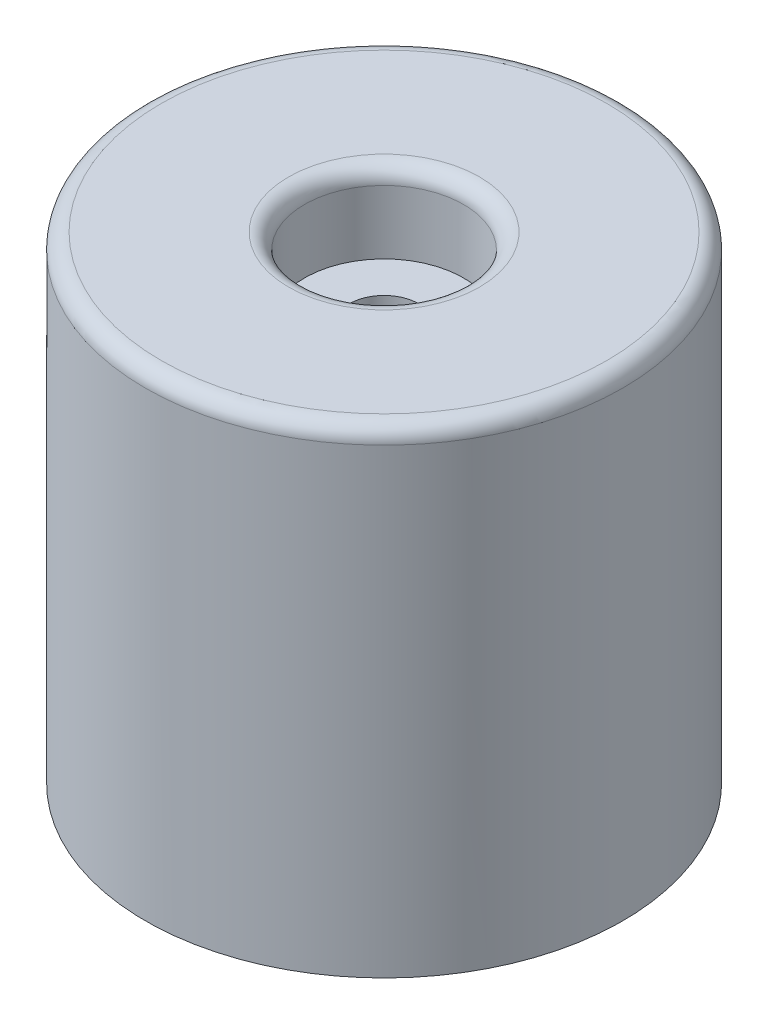
from build123d import *

# Parameters (mm, degrees)
SKETCH1_R           = 19.05
BOSS_EXTRUDE1_DEPTH = 38.1
SKETCH2_R           = 6.35
CUT_EXTRUDE1_DEPTH  = 6.35
SKETCH3_R           = 2.778125
CUT_EXTRUDE2_DEPTH  = 42.639734629
FILLET1_R           = 1.27


with BuildPart() as part:
    # Sketch1 → Boss-Extrude1 (new body)
    with BuildSketch(Plane(origin=(0, 0, 0), x_dir=(1, 0, 0), z_dir=(0, 1, 0))):
        Circle(SKETCH1_R)
    extrude(amount=BOSS_EXTRUDE1_DEPTH)

    # Sketch2 → Cut-Extrude1 (cut)
    with BuildSketch(Plane(origin=(0, 38.1, 0), x_dir=(1, 0, 0), z_dir=(0, 1, 0))):
        Circle(SKETCH2_R)
    extrude(amount=-CUT_EXTRUDE1_DEPTH, mode=Mode.SUBTRACT)

    # Sketch3 → Cut-Extrude2 (cut, through all)
    with BuildSketch(Plane(origin=(0, 31.75, 0), x_dir=(1, 0, 0), z_dir=(0, 1, 0))):
        Circle(SKETCH3_R)
    extrude(amount=-CUT_EXTRUDE2_DEPTH, mode=Mode.SUBTRACT)

    # Fillet1
    fillet1_edges = [part.edges().sort_by_distance(p)[0] for p in [
        (-6.35, 38.1, 0),
        (-19.05, 38.1, 0),
    ]]
    fillet(fillet1_edges, radius=FILLET1_R)


solid = part.part
